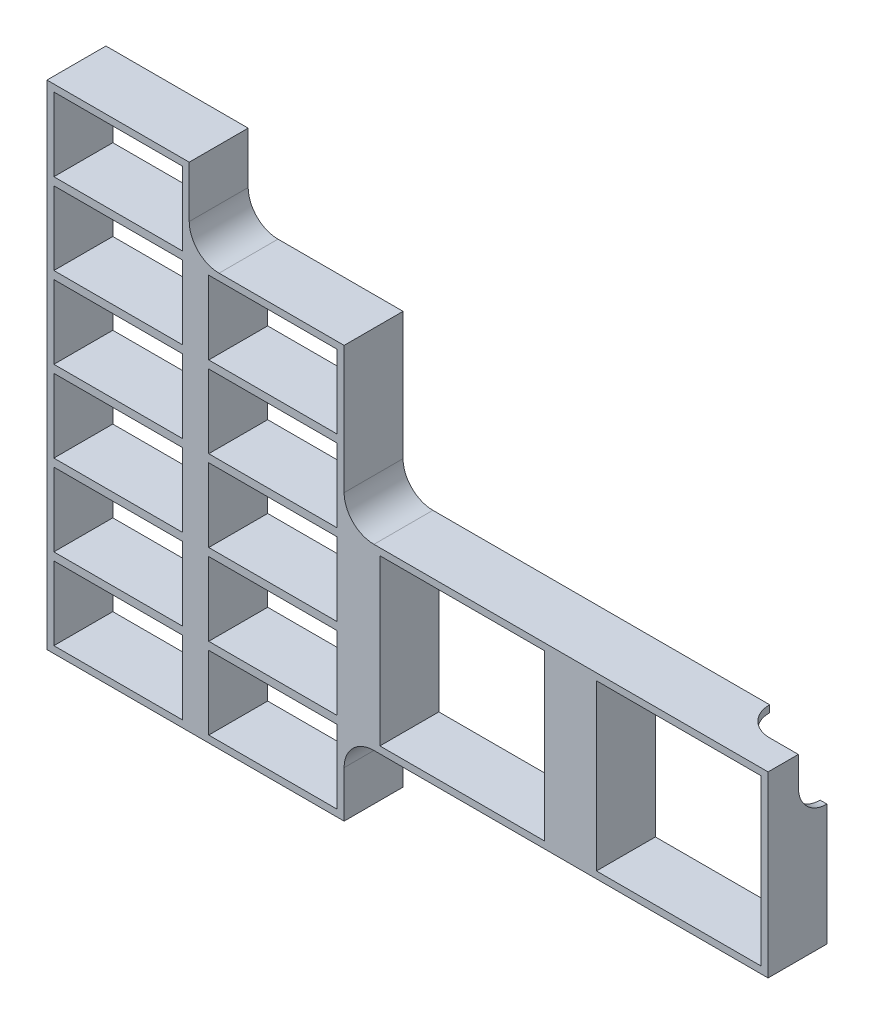
from build123d import *

# Parameters (mm, degrees)
PART2_EYEBROW_START                          = -6.52585
PART2_EYEBROW_WARNING_MODULE_MIRRORED_OU_W   = 14.224
PART2_EYEBROW_WARNING_MODULE_MIRRORED_OU_H   = 8.128
PART2_EYEBROW_WARNING_MODULE_MIRRORED_OU_W_2 = 18.2372
PART2_EYEBROW_WARNING_MODULE_MIRRORED_OU_H_2 = 18.2372
PART2_EYEBROW_WARNING_MODULE_MIRRORED_DEPTH  = 6.52585
SKETCH2_W                                    = 6.35
SKETCH2_H                                    = 6.35
CUT_EXTRUDE1_DEPTH                           = 3.175
FILLET1_R                                    = 3.175


# Read off the part's stored shape, not the designer's step: Part2^Eyebrow Warning Module_Mirrored
with BuildPart() as part:
    # Part2^Eyebrow Warning Module_Mirrored ou → Part2^Eyebrow Warning Module_Mirrored (new body)
    with BuildSketch(Plane.XY.offset(PART2_EYEBROW_START)):
        with BuildLine():
            Line((573.893747576, 540.0294), (560.050747576, 540.0294))
            ThreePointArc((560.050747576, 540.0294), (557.715880985, 540.996533409), (556.748747576, 543.3314))
            Line((556.748747576, 543.3314), (556.748747576, 549.021))
            Line((556.748747576, 549.021), (541.000747576, 549.021))
            Line((541.000747576, 549.021), (541.000747576, 494.411))
            Line((541.000747576, 494.411), (573.893747576, 494.411))
            Line((573.893747576, 494.411), (573.893747576, 499.5418))
            ThreePointArc((573.893747576, 499.5418), (574.860880985, 501.876666591), (577.195747576, 502.8438))
            Line((577.195747576, 502.8438), (620.829097092, 502.8438))
            Line((620.829097092, 502.8438), (620.829097092, 522.605))
            Line((620.829097092, 522.605), (577.195747576, 522.605))
            ThreePointArc((577.195747576, 522.605), (574.860880985, 523.572133409), (573.893747576, 525.907))
            Line((573.893747576, 525.907), (573.893747576, 540.0294))
        make_face()
        with Locations((548.874747576, 499.237)):
            Rectangle(PART2_EYEBROW_WARNING_MODULE_MIRRORED_OU_W, PART2_EYEBROW_WARNING_MODULE_MIRRORED_OU_H, mode=Mode.SUBTRACT)
        with Locations((566.019747576, 499.237)):
            Rectangle(PART2_EYEBROW_WARNING_MODULE_MIRRORED_OU_W, PART2_EYEBROW_WARNING_MODULE_MIRRORED_OU_H, mode=Mode.SUBTRACT)
        with Locations((548.874747576, 508.2286)):
            Rectangle(PART2_EYEBROW_WARNING_MODULE_MIRRORED_OU_W, PART2_EYEBROW_WARNING_MODULE_MIRRORED_OU_H, mode=Mode.SUBTRACT)
        with Locations((548.874747576, 517.2202)):
            Rectangle(PART2_EYEBROW_WARNING_MODULE_MIRRORED_OU_W, PART2_EYEBROW_WARNING_MODULE_MIRRORED_OU_H, mode=Mode.SUBTRACT)
        with Locations((566.019747576, 508.2286)):
            Rectangle(PART2_EYEBROW_WARNING_MODULE_MIRRORED_OU_W, PART2_EYEBROW_WARNING_MODULE_MIRRORED_OU_H, mode=Mode.SUBTRACT)
        with Locations((566.019747576, 517.2202)):
            Rectangle(PART2_EYEBROW_WARNING_MODULE_MIRRORED_OU_W, PART2_EYEBROW_WARNING_MODULE_MIRRORED_OU_H, mode=Mode.SUBTRACT)
        with Locations((586.974747576, 512.7244)):
            Rectangle(PART2_EYEBROW_WARNING_MODULE_MIRRORED_OU_W_2, PART2_EYEBROW_WARNING_MODULE_MIRRORED_OU_H_2, mode=Mode.SUBTRACT)
        with Locations((610.948497092, 512.7244)):
            Rectangle(PART2_EYEBROW_WARNING_MODULE_MIRRORED_OU_W_2, PART2_EYEBROW_WARNING_MODULE_MIRRORED_OU_H_2, mode=Mode.SUBTRACT)
        with Locations((548.874747576, 526.2118)):
            Rectangle(PART2_EYEBROW_WARNING_MODULE_MIRRORED_OU_W, PART2_EYEBROW_WARNING_MODULE_MIRRORED_OU_H, mode=Mode.SUBTRACT)
        with Locations((548.874747576, 535.2034)):
            Rectangle(PART2_EYEBROW_WARNING_MODULE_MIRRORED_OU_W, PART2_EYEBROW_WARNING_MODULE_MIRRORED_OU_H, mode=Mode.SUBTRACT)
        with Locations((566.019747576, 526.2118)):
            Rectangle(PART2_EYEBROW_WARNING_MODULE_MIRRORED_OU_W, PART2_EYEBROW_WARNING_MODULE_MIRRORED_OU_H, mode=Mode.SUBTRACT)
        with Locations((566.019747576, 535.2034)):
            Rectangle(PART2_EYEBROW_WARNING_MODULE_MIRRORED_OU_W, PART2_EYEBROW_WARNING_MODULE_MIRRORED_OU_H, mode=Mode.SUBTRACT)
        with Locations((548.874747576, 544.195)):
            Rectangle(PART2_EYEBROW_WARNING_MODULE_MIRRORED_OU_W, PART2_EYEBROW_WARNING_MODULE_MIRRORED_OU_H, mode=Mode.SUBTRACT)
    extrude(amount=PART2_EYEBROW_WARNING_MODULE_MIRRORED_DEPTH)

    # Sketch2 → Cut-Extrude1 (cut)
    with BuildSketch(Plane(origin=(0, 0, -6.52585), x_dir=(-1, 0, 0), z_dir=(0, 0, -1))):
        with Locations((-617.654097092, 519.43)):
            Rectangle(SKETCH2_W, SKETCH2_H)
    extrude(amount=-CUT_EXTRUDE1_DEPTH, mode=Mode.SUBTRACT)

    # Fillet1
    fillet1_edges = [part.edges().sort_by_distance(p)[0] for p in [
        (614.479097092, 522.224, -3.35085),
        (620.448097092, 516.255, -3.35085),
    ]]
    fillet(fillet1_edges, radius=FILLET1_R - 0.0001)  # a hair under: the kernel refuses the full size


solid = part.part
